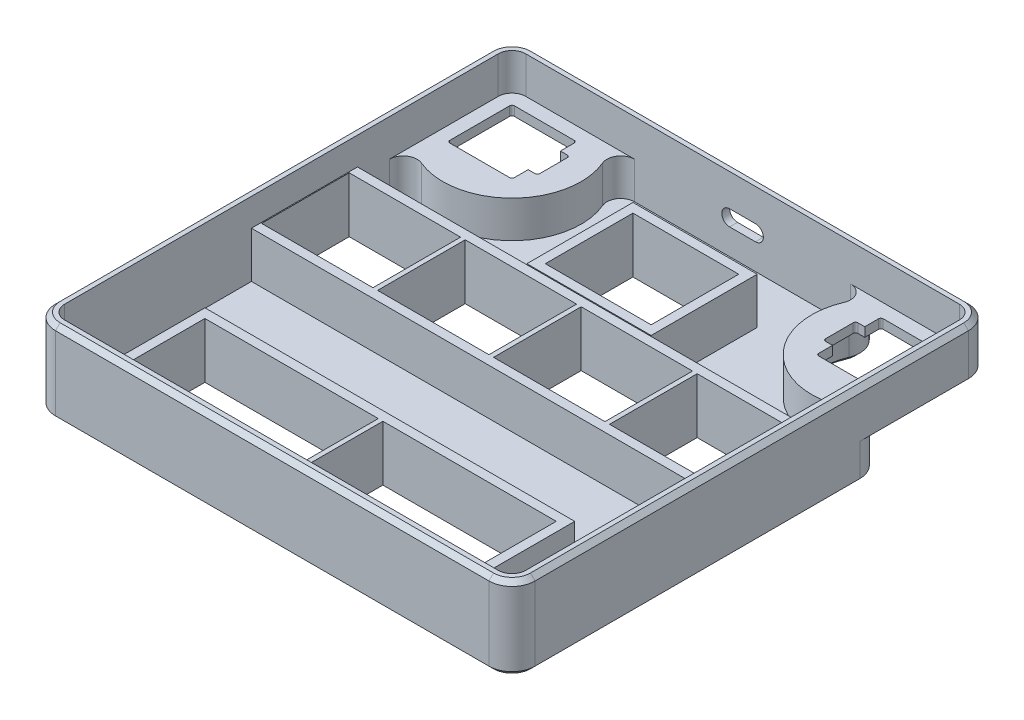
from build123d import *

# Parameters (mm, degrees)
SKETCH_1_W            = 22.95
SKETCH_1_H            = 19
SKETCH_1_W_2          = 37.6
SKETCH_1_W_3          = 24.15
EXTRUDE_7_DEPTH       = 2
SKETCH_4_R            = 15
CUT_EXTRUDE_1_DEPTH   = 18
FILLET_1_R            = 3
FILLET_2_R            = 3
SKETCH_1_6_W          = 26.95
SKETCH_1_6_H          = 23
SKETCH_1_6_W_2        = 22.95
SKETCH_1_6_H_2        = 19
EXTRUDE_3_DEPTH       = 12
EXTRUDE_4_OUTLINE_W   = 103.6
EXTRUDE_4_OUTLINE_H   = 23
EXTRUDE_4_OUTLINE_W_2 = 23.15
EXTRUDE_4_OUTLINE_H_2 = 19
EXTRUDE_4_OUTLINE_W_3 = 22.15
EXTRUDE_4_DEPTH       = 12
EXTRUDE_5_OUTLINE_W   = 80.2
EXTRUDE_5_OUTLINE_H   = 23
EXTRUDE_5_OUTLINE_W_2 = 36.6
EXTRUDE_5_OUTLINE_H_2 = 19
EXTRUDE_5_DEPTH       = 12
EXTRUDE_START         = -2
EXTRUDE_7_2_DEPTH     = 18
SKETCH_11_W           = 28.583123952
SKETCH_11_H           = 28.583123952
CUT_EXTRUDE_8_DEPTH   = 10
EXTRUDE_8_DEPTH       = 2
EXTRUDE_9_DEPTH       = 2
EXTRUDE_12_DEPTH      = 8
CHAMFER_1_SIZE        = 1
CHAMFER_2_SIZE        = 1
CUT_EXTRUDE_9_DEPTH   = 2
CUT_EXTRUDE_10_DEPTH  = 0.3
CHAMFER_3_SIZE        = 0.32
SKETCH_1_11_W         = 37.6
SKETCH_1_11_H         = 19
SKETCH_1_11_W_2       = 24.15
CUT_EXTRUDE_12_DEPTH  = 12


# Read off the part's stored shape, not the designer's step: 拉伸-薄壁4, 拉伸-薄壁5
with BuildPart() as part:
    # 草图1 → Extrude 7 (new body)
    with BuildSketch(Plane(origin=(0, 0, 0), x_dir=(1, 0, 0), z_dir=(0, 1, 0))):
        with BuildLine():
            Line((3, 0), (97, 0))
            ThreePointArc((97, 0), (99.121320344, 0.878679656), (100, 3))
            Line((100, 3), (100, 97))
            ThreePointArc((100, 97), (99.121320344, 99.121320344), (97, 100))
            Line((97, 100), (3, 100))
            ThreePointArc((3, 100), (0.878679656, 99.121320344), (0, 97))
            Line((0, 97), (0, 3))
            ThreePointArc((0, 3), (0.878679656, 0.878679656), (3, 0))
        make_face()
        with Locations((50, 78.2)):
            Rectangle(SKETCH_1_W, SKETCH_1_H, mode=Mode.SUBTRACT)
        with Locations((30.7, 12)):
            Rectangle(SKETCH_1_W_2, SKETCH_1_H, mode=Mode.SUBTRACT)
        with Locations((87.725, 55)):
            Rectangle(SKETCH_1_W_3, SKETCH_1_H, mode=Mode.SUBTRACT)
        with Locations((37.425, 55)):
            Rectangle(SKETCH_1_W_3, SKETCH_1_H, mode=Mode.SUBTRACT)
        with Locations((62.575, 55)):
            Rectangle(SKETCH_1_W_3, SKETCH_1_H, mode=Mode.SUBTRACT)
        with Locations((12.275, 55)):
            Rectangle(SKETCH_1_W_3, SKETCH_1_H, mode=Mode.SUBTRACT)
        with Locations((69.3, 12)):
            Rectangle(SKETCH_1_W_2, SKETCH_1_H, mode=Mode.SUBTRACT)
    extrude(amount=EXTRUDE_7_DEPTH)

    # 草图4 → 切除-拉伸1 (cut)
    with BuildSketch(Plane(origin=(0, 2, 0), x_dir=(1, 0, 0), z_dir=(0, 1, 0))):
        with Locations((10, 90)):
            Circle(SKETCH_4_R)
        with Locations((90, 90)):
            Circle(SKETCH_4_R)
    extrude(amount=-CUT_EXTRUDE_1_DEPTH, mode=Mode.SUBTRACT)

    # 圆角1
    fillet_1_edges = [part.edges().sort_by_distance(p)[0] for p in [
        (21.180339887, 1, -100),
        (0, 1, -78.819660113),
    ]]
    fillet(fillet_1_edges, radius=FILLET_1_R)

    # 圆角2
    fillet_2_edges = [part.edges().sort_by_distance(p)[0] for p in [
        (78.819660113, 1, -100),
        (100, 1, -78.819660113),
    ]]
    fillet(fillet_2_edges, radius=FILLET_2_R)

    # 草图1<6> → 拉伸-薄壁3 (add)
    with BuildSketch(Plane(origin=(0, 0, 0), x_dir=(1, 0, 0), z_dir=(0, 1, 0))):
        with Locations((50, 78.2)):
            Rectangle(SKETCH_1_6_W, SKETCH_1_6_H)
        with Locations((50, 78.2)):
            Rectangle(SKETCH_1_6_W_2, SKETCH_1_6_H_2, mode=Mode.SUBTRACT)
    extrude(amount=EXTRUDE_3_DEPTH)

    # 拉伸-薄壁4 outline → 拉伸-薄壁4 (add)
    with BuildSketch(Plane(origin=(0, 0, 0), x_dir=(1, 0, 0), z_dir=(0, 1, 0))):
        with Locations((50, 55)):
            Rectangle(EXTRUDE_4_OUTLINE_W, EXTRUDE_4_OUTLINE_H)
        with Locations((11.775, 55)):
            Rectangle(EXTRUDE_4_OUTLINE_W_2, EXTRUDE_4_OUTLINE_H_2, mode=Mode.SUBTRACT)
        with Locations((37.425, 55)):
            Rectangle(EXTRUDE_4_OUTLINE_W_3, EXTRUDE_4_OUTLINE_H_2, mode=Mode.SUBTRACT)
        with Locations((62.575, 55)):
            Rectangle(EXTRUDE_4_OUTLINE_W_3, EXTRUDE_4_OUTLINE_H_2, mode=Mode.SUBTRACT)
        with Locations((88.225, 55)):
            Rectangle(EXTRUDE_4_OUTLINE_W_2, EXTRUDE_4_OUTLINE_H_2, mode=Mode.SUBTRACT)
    extrude(amount=EXTRUDE_4_DEPTH)

    # 拉伸-薄壁5 outline → 拉伸-薄壁5 (add)
    with BuildSketch(Plane(origin=(0, 0, 0), x_dir=(1, 0, 0), z_dir=(0, 1, 0))):
        with Locations((50, 12)):
            Rectangle(EXTRUDE_5_OUTLINE_W, EXTRUDE_5_OUTLINE_H)
        with Locations((30.2, 12)):
            Rectangle(EXTRUDE_5_OUTLINE_W_2, EXTRUDE_5_OUTLINE_H_2, mode=Mode.SUBTRACT)
        with Locations((69.8, 12)):
            Rectangle(EXTRUDE_5_OUTLINE_W_2, EXTRUDE_5_OUTLINE_H_2, mode=Mode.SUBTRACT)
    extrude(amount=EXTRUDE_5_DEPTH)

    # 草图10 → Extrude 7 2 (add)
    with BuildSketch(Plane(origin=(0, 2, 0), x_dir=(1, 0, 0), z_dir=(0, 1, 0)).offset(EXTRUDE_START)):
        with BuildLine():
            Line((-2, 3), (-2, 73.416876048))
            ThreePointArc((-2, 73.416876048), (0.236146008, 77.583542715), (4.944444444, 78.023299368))
            ThreePointArc((4.944444444, 78.023299368), (19.192388155, 80.807611845), (21.976700632, 95.055555556))
            ThreePointArc((21.976700632, 95.055555556), (22.416457285, 99.763853992), (26.583123952, 102))
            Line((26.583123952, 102), (73.416876048, 102))
            ThreePointArc((73.416876048, 102), (77.583542715, 99.763853992), (78.023299368, 95.055555556))
            ThreePointArc((78.023299368, 95.055555556), (80.807611845, 80.807611845), (95.055555556, 78.023299368))
            ThreePointArc((95.055555556, 78.023299368), (99.763853992, 77.583542715), (102, 73.416876048))
            Line((102, 73.416876048), (102, 3))
            ThreePointArc((102, 3), (100.535533906, -0.535533906), (97, -2))
            Line((97, -2), (3, -2))
            ThreePointArc((3, -2), (-0.535533906, -0.535533906), (-2, 3))
        make_face()
        with BuildLine():
            Line((0, 3), (0, 73.416876048))
            ThreePointArc((0, 73.416876048), (1.341687605, 75.916876048), (4.166666667, 76.18073004))
            ThreePointArc((4.166666667, 76.18073004), (20.606601718, 79.393398282), (23.81926996, 95.833333333))
            ThreePointArc((23.81926996, 95.833333333), (24.083123952, 98.658312395), (26.583123952, 100))
            Line((26.583123952, 100), (73.416876048, 100))
            ThreePointArc((73.416876048, 100), (75.916876048, 98.658312395), (76.18073004, 95.833333333))
            ThreePointArc((76.18073004, 95.833333333), (79.393398282, 79.393398282), (95.833333333, 76.18073004))
            ThreePointArc((95.833333333, 76.18073004), (98.658312395, 75.916876048), (100, 73.416876048))
            Line((100, 73.416876048), (100, 3))
            ThreePointArc((100, 3), (99.121320344, 0.878679656), (97, 0))
            Line((97, 0), (3, 0))
            ThreePointArc((3, 0), (0.878679656, 0.878679656), (0, 3))
        make_face(mode=Mode.SUBTRACT)
    extrude(amount=EXTRUDE_7_2_DEPTH)

    # 草图11 → 切除-拉伸8 (cut)
    with BuildSketch(Plane(origin=(0, 18, 0), x_dir=(1, 0, 0), z_dir=(0, 1, 0))):
        with Locations((87.708438024, 87.708438024)):
            Rectangle(SKETCH_11_W, SKETCH_11_H)
        with Locations((12.291561976, 87.708438024)):
            Rectangle(SKETCH_11_W, SKETCH_11_H)
    extrude(amount=-CUT_EXTRUDE_8_DEPTH, mode=Mode.SUBTRACT)

    # 草图13 → 凸台-拉伸8 (add)
    with BuildSketch(Plane(origin=(0, 8, 0), x_dir=(1, 0, 0), z_dir=(0, 1, 0))):
        with BuildLine():
            Line((26.583123952, 102), (26.583123952, 100))
            ThreePointArc((26.583123952, 100), (24.083123952, 98.658312395), (23.81926996, 95.833333333))
            ThreePointArc((23.81926996, 95.833333333), (20.606601718, 79.393398282), (4.166666667, 76.18073004))
            ThreePointArc((4.166666667, 76.18073004), (1.341687605, 75.916876048), (0, 73.416876048))
            Line((0, 73.416876048), (-2, 73.416876048))
            Line((-2, 73.416876048), (-2, 97))
            ThreePointArc((-2, 97), (-0.535533906, 100.535533906), (3, 102))
            Line((3, 102), (26.583123952, 102))
        make_face()
        with BuildLine():
            Line((18.5, 93.5), (17, 93.5))
            Line((17, 93.5), (17, 96.5))
            ThreePointArc((17, 96.5), (16.853553391, 96.853553391), (16.5, 97))
            Line((16.5, 97), (3.5, 97))
            ThreePointArc((3.5, 97), (3.146446609, 96.853553391), (3, 96.5))
            Line((3, 96.5), (3, 83.5))
            ThreePointArc((3, 83.5), (3.146446609, 83.146446609), (3.5, 83))
            Line((3.5, 83), (16.5, 83))
            ThreePointArc((16.5, 83), (16.853553391, 83.146446609), (17, 83.5))
            Line((17, 83.5), (17, 86.5))
            Line((17, 86.5), (18.5, 86.5))
            ThreePointArc((18.5, 86.5), (18.853553391, 86.646446609), (19, 87))
            Line((19, 87), (19, 93))
            ThreePointArc((19, 93), (18.853553391, 93.353553391), (18.5, 93.5))
        make_face(mode=Mode.SUBTRACT)
    extrude(amount=EXTRUDE_8_DEPTH)

    # 草图15 → 凸台-拉伸9 (add)
    with BuildSketch(Plane(origin=(0, 8, 0), x_dir=(1, 0, 0), z_dir=(0, 1, 0))):
        with BuildLine():
            Line((73.416876048, 102), (97, 102))
            ThreePointArc((97, 102), (100.535533906, 100.535533906), (102, 97))
            Line((102, 97), (102, 73.416876048))
            Line((102, 73.416876048), (100, 73.416876048))
            ThreePointArc((100, 73.416876048), (98.658312395, 75.916876048), (95.833333333, 76.18073004))
            ThreePointArc((95.833333333, 76.18073004), (79.393398282, 79.393398282), (76.18073004, 95.833333333))
            ThreePointArc((76.18073004, 95.833333333), (75.916876048, 98.658312395), (73.416876048, 100))
            Line((73.416876048, 100), (73.416876048, 102))
        make_face()
        with BuildLine():
            Line((83, 86.5), (83, 83.5))
            ThreePointArc((83, 83.5), (83.146446609, 83.146446609), (83.5, 83))
            Line((83.5, 83), (96.5, 83))
            ThreePointArc((96.5, 83), (96.853553391, 83.146446609), (97, 83.5))
            Line((97, 83.5), (97, 96.5))
            ThreePointArc((97, 96.5), (96.853553391, 96.853553391), (96.5, 97))
            Line((96.5, 97), (83.5, 97))
            ThreePointArc((83.5, 97), (83.146446609, 96.853553391), (83, 96.5))
            Line((83, 96.5), (83, 93.5))
            Line((83, 93.5), (81.5, 93.5))
            ThreePointArc((81.5, 93.5), (81.146446609, 93.353553391), (81, 93))
            Line((81, 93), (81, 87))
            ThreePointArc((81, 87), (81.146446609, 86.646446609), (81.5, 86.5))
            Line((81.5, 86.5), (83, 86.5))
        make_face(mode=Mode.SUBTRACT)
    extrude(amount=EXTRUDE_9_DEPTH)

    # 草图18 → 凸台-拉伸12 (add)
    with BuildSketch(Plane(origin=(0, 10, 0), x_dir=(1, 0, 0), z_dir=(0, 1, 0))):
        with BuildLine():
            Line((0, 73.416876048), (-2, 73.416876048))
            Line((-2, 73.416876048), (-2, 97))
            ThreePointArc((-2, 97), (-0.535533906, 100.535533906), (3, 102))
            Line((3, 102), (26.583123952, 102))
            Line((26.583123952, 102), (26.583123952, 100))
            Line((26.583123952, 100), (3, 100))
            ThreePointArc((3, 100), (0.878679656, 99.121320344), (0, 97))
            Line((0, 97), (0, 73.416876048))
        make_face()
        with BuildLine():
            Line((73.416876048, 102), (73.416876048, 100))
            Line((73.416876048, 100), (97, 100))
            ThreePointArc((97, 100), (99.121320344, 99.121320344), (100, 97))
            Line((100, 97), (100, 73.416876048))
            Line((100, 73.416876048), (102, 73.416876048))
            Line((102, 73.416876048), (102, 97))
            ThreePointArc((102, 97), (100.535533906, 100.535533906), (97, 102))
            Line((97, 102), (73.416876048, 102))
        make_face()
    extrude(amount=EXTRUDE_12_DEPTH)

    # 倒角1
    chamfer_1_edges = [part.edges().sort_by_distance(p)[0] for p in [
        (80.807611845, 0, -80.807611845),
        (19.192388155, 0, -80.807611845),
        (50, 0, 2),
        (-0.535533906, 0, 0.535533906),
        (-2, 0, -38.208438024),
        (0.236146008, 0, -77.583542715),
        (22.416457285, 0, -99.763853992),
        (50, 0, -102),
        (77.583542715, 0, -99.763853992),
        (99.763853992, 0, -77.583542715),
        (102, 0, -38.208438024),
        (100.535533906, 0, 0.535533906),
    ]]
    chamfer(chamfer_1_edges, length=CHAMFER_1_SIZE)

    # 倒角2
    chamfer_2_edges = [part.edges().sort_by_distance(p)[0] for p in [
        (50, 18, 2),
        (100.535533906, 18, 0.535533906),
        (102, 18, -50),
        (50, 18, -102),
        (-2, 18, -50),
        (-0.535533906, 18, 0.535533906),
        (100.535533906, 18, -100.535533906),
        (-0.535533906, 18, -100.535533906),
    ]]
    chamfer(chamfer_2_edges, length=CHAMFER_2_SIZE)

    # 草图20 → 切除-拉伸9 (cut)
    with BuildSketch(Plane(origin=(0, 0, -102), x_dir=(-1, 0, 0), z_dir=(0, 0, -1))):
        with BuildLine():
            Line((-52.8, 7.6), (-47.2, 7.6))
            ThreePointArc((-47.2, 7.6), (-45.5, 9.3), (-47.2, 11))
            Line((-47.2, 11), (-52.8, 11))
            ThreePointArc((-52.8, 11), (-54.5, 9.3), (-52.8, 7.6))
        make_face()
    extrude(amount=-CUT_EXTRUDE_9_DEPTH, mode=Mode.SUBTRACT)

    # 草图20<3> → 切除-拉伸10 (cut)
    with BuildSketch(Plane(origin=(0, 0, -102), x_dir=(-1, 0, 0), z_dir=(0, 0, -1))):
        with BuildLine():
            Line((-52.8, 13), (-47.2, 13))
            ThreePointArc((-47.2, 13), (-43.5, 9.3), (-47.2, 5.6))
            Line((-47.2, 5.6), (-52.8, 5.6))
            ThreePointArc((-52.8, 5.6), (-56.5, 9.3), (-52.8, 13))
        make_face()
    extrude(amount=-CUT_EXTRUDE_10_DEPTH, mode=Mode.SUBTRACT)

    # 倒角3
    # the kernel refuses this chamfer: 0.32 mm, written as the material it adds along each edge
    # the kernel refuses this chamfer: 0.32 mm, written as the material it takes off along each edge
    with BuildSketch(Plane(origin=(47.2, 5.6, -102), x_dir=(0, -0.9996219169112974, -0.027495876610561392), z_dir=(1, 0, 0))) as chamfer_3_2_piece_1_section:
        Polygon((CHAMFER_3_SIZE * 0.999621916911, -CHAMFER_3_SIZE * 0.0274958766106), (-CHAMFER_3_SIZE * 0.0274958766106, -CHAMFER_3_SIZE * 0.999621916911), (0, 0), align=None)
    chamfer_3_2_piece_1 = extrude(amount=5.6, mode=Mode.PRIVATE)
    chamfer_3_2_piece_1 = split(chamfer_3_2_piece_1, bisect_by=Plane(origin=(50, 5.492941176, -101.7), z_dir=(0, 0, -1)), keep=Keep.TOP, mode=Mode.PRIVATE)
    add(chamfer_3_2_piece_1, mode=Mode.SUBTRACT)
    with BuildSketch(Plane(origin=(47.2, 9.3, -102), x_dir=(0, 1, 0), z_dir=(1, 0, 0))) as chamfer_3_2_piece_2_section:
        Polygon((3.7 + CHAMFER_3_SIZE, 0), (3.7, CHAMFER_3_SIZE), (3.7, 0), align=None)
    chamfer_3_2_piece_2 = revolve(axis=Axis((47.2, 9.3, -102), (0, 0, 1)), revolution_arc=180, mode=Mode.PRIVATE)
    chamfer_3_2_piece_2 = split(chamfer_3_2_piece_2, bisect_by=Plane(origin=(46.708459178, 13.091931565, -101.7), z_dir=(0, 0, -1)), keep=Keep.TOP, mode=Mode.PRIVATE)
    add(chamfer_3_2_piece_2, mode=Mode.SUBTRACT)
    with BuildSketch(Plane(origin=(52.8, 13, -102), x_dir=(0, 0.9996219169112974, -0.027495876610561392), z_dir=(-1, 0, 0))) as chamfer_3_2_piece_3_section:
        Polygon((CHAMFER_3_SIZE * 0.999621916911, -CHAMFER_3_SIZE * 0.0274958766106), (-CHAMFER_3_SIZE * 0.0274958766106, -CHAMFER_3_SIZE * 0.999621916911), (0, 0), align=None)
    chamfer_3_2_piece_3 = extrude(amount=5.6, mode=Mode.PRIVATE)
    chamfer_3_2_piece_3 = split(chamfer_3_2_piece_3, bisect_by=Plane(origin=(50, 13.107058824, -101.7), z_dir=(0, 0, -1)), keep=Keep.TOP, mode=Mode.PRIVATE)
    add(chamfer_3_2_piece_3, mode=Mode.SUBTRACT)
    with BuildSketch(Plane(origin=(52.8, 9.3, -102), x_dir=(0, -1, 0), z_dir=(-1, 0, 0))) as chamfer_3_2_piece_4_section:
        Polygon((3.7 + CHAMFER_3_SIZE, 0), (3.7, CHAMFER_3_SIZE), (3.7, 0), align=None)
    chamfer_3_2_piece_4 = revolve(axis=Axis((52.8, 9.3, -102), (0, 0, 1)), revolution_arc=180, mode=Mode.PRIVATE)
    chamfer_3_2_piece_4 = split(chamfer_3_2_piece_4, bisect_by=Plane(origin=(53.291540822, 5.508068435, -101.7), z_dir=(0, 0, -1)), keep=Keep.TOP, mode=Mode.PRIVATE)
    add(chamfer_3_2_piece_4, mode=Mode.SUBTRACT)

    # 草图1<11> → 切除-拉伸12 (cut)
    with BuildSketch(Plane(origin=(0, 0, 0), x_dir=(1, 0, 0), z_dir=(0, 1, 0))):
        with Locations((30.7, 12)):
            Rectangle(SKETCH_1_11_W, SKETCH_1_11_H)
        with Locations((87.725, 55)):
            Rectangle(SKETCH_1_11_W_2, SKETCH_1_11_H)
        with Locations((37.425, 55)):
            Rectangle(SKETCH_1_11_W_2, SKETCH_1_11_H)
        with Locations((62.575, 55)):
            Rectangle(SKETCH_1_11_W_2, SKETCH_1_11_H)
        with Locations((12.275, 55)):
            Rectangle(SKETCH_1_11_W_2, SKETCH_1_11_H)
        with Locations((69.3, 12)):
            Rectangle(SKETCH_1_11_W, SKETCH_1_11_H)
    extrude(amount=CUT_EXTRUDE_12_DEPTH, mode=Mode.SUBTRACT)


solid = part.part
